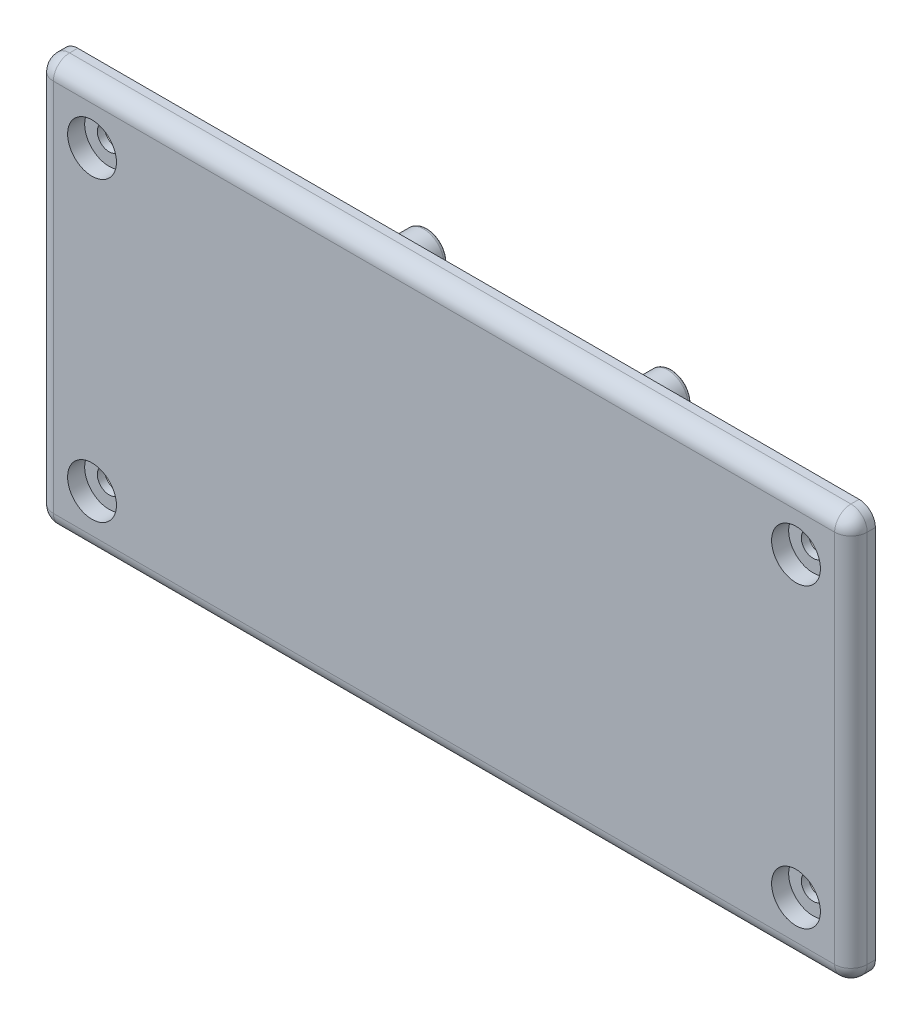
from build123d import *

# Parameters (mm, degrees)
BOSS_EXTRUDE1_DEPTH                                = 3
FILLET1_R                                          = 2
SKETCH2_W                                          = 10
SKETCH2_H                                          = 3
SKETCH2_W_2                                        = 3
SKETCH2_H_2                                        = 20
BOSS_EXTRUDE2_DEPTH                                = 1.5
FILLET2_R                                          = 1
SKETCH3_R                                          = 2.5099
BOSS_EXTRUDE3_DEPTH                                = 10
FILLET3_R                                          = 0.5
CBORE_FOR_M2_5_PAN_HEAD_MACHINE_SCREW1_D           = 2.9
CBORE_FOR_M2_5_PAN_HEAD_MACHINE_SCREW1_DEPTH       = 6.35
CBORE_FOR_M2_5_PAN_HEAD_MACHINE_SCREW1_CBORE_D     = 6
CBORE_FOR_M2_5_PAN_HEAD_MACHINE_SCREW1_CBORE_DEPTH = 2.1
CBORE_FOR_M2_5_PAN_HEAD_MACHINE_SCREW1_TIP         = 0.871247898


with BuildPart() as part:
    # Sketch1 → Boss-Extrude1 (new body)
    with BuildSketch(Plane.XY):
        with BuildLine():
            Line((-48, -25), (48, -25))
            ThreePointArc((48, -25), (49.414213562, -24.414213562), (50, -23))
            Line((50, -23), (50, 23))
            ThreePointArc((50, 23), (49.414213562, 24.414213562), (48, 25))
            Line((48, 25), (-48, 25))
            ThreePointArc((-48, 25), (-49.414213562, 24.414213562), (-50, 23))
            Line((-50, 23), (-50, -23))
            ThreePointArc((-50, -23), (-49.414213562, -24.414213562), (-48, -25))
        make_face()
    extrude(amount=BOSS_EXTRUDE1_DEPTH)

    # Fillet1
    fillet1_edges = [part.edges().sort_by_distance(p)[0] for p in [
        (-50, 0, 3),
        (-49.414213562, 24.414213562, 3),
        (0, 25, 3),
        (49.414213562, 24.414213562, 3),
        (50, 0, 3),
        (49.414213562, -24.414213562, 3),
        (0, -25, 3),
        (-49.414213562, -24.414213562, 3),
    ]]
    fillet(fillet1_edges, radius=FILLET1_R)

    # Sketch2 → Boss-Extrude2 (add)
    with BuildSketch(Plane(origin=(0, 0, 0), x_dir=(-1, 0, 0), z_dir=(0, 0, -1))):
        with Locations((-30, -20)):
            Rectangle(SKETCH2_W, SKETCH2_H)
        with Locations((30, -20)):
            Rectangle(SKETCH2_W, SKETCH2_H)
        with Locations((-45, 0)):
            Rectangle(SKETCH2_W_2, SKETCH2_H_2)
        with Locations((45, 0)):
            Rectangle(SKETCH2_W_2, SKETCH2_H_2)
        with Locations((-30, 20)):
            Rectangle(SKETCH2_W, SKETCH2_H)
        with Locations((30, 20)):
            Rectangle(SKETCH2_W, SKETCH2_H)
    extrude(amount=BOSS_EXTRUDE2_DEPTH)

    # Fillet2
    fillet2_edges = [part.edges().sort_by_distance(p)[0] for p in [
        (-25, 20, -1.5),
        (-30, 21.5, -1.5),
        (-35, 20, -1.5),
        (-30, 18.5, -1.5),
        (-35, -20, -1.5),
        (-30, -21.5, -1.5),
        (-25, -20, -1.5),
        (-30, -18.5, -1.5),
        (-45, 10, -1.5),
        (-46.5, 0, -1.5),
        (-45, -10, -1.5),
        (-43.5, 0, -1.5),
        (25, -20, -1.5),
        (30, -21.5, -1.5),
        (35, -20, -1.5),
        (30, -18.5, -1.5),
        (46.5, 0, -1.5),
        (45, 10, -1.5),
        (43.5, 0, -1.5),
        (45, -10, -1.5),
        (30, 21.5, -1.5),
        (25, 20, -1.5),
        (30, 18.5, -1.5),
        (35, 20, -1.5),
        (-25, 21.5, -0.75),
        (-35, 21.5, -0.75),
        (-35, 18.5, -0.75),
        (-25, 18.5, -0.75),
        (-25, -18.5, -0.75),
        (-25, -21.5, -0.75),
        (-35, -21.5, -0.75),
        (-35, -18.5, -0.75),
        (-46.5, -10, -0.75),
        (-43.5, -10, -0.75),
        (-46.5, 10, -0.75),
        (-43.5, 10, -0.75),
        (25, -18.5, -0.75),
        (25, -21.5, -0.75),
        (35, -18.5, -0.75),
        (35, -21.5, -0.75),
        (25, 21.5, -0.75),
        (25, 18.5, -0.75),
        (35, 21.5, -0.75),
        (35, 18.5, -0.75),
        (43.5, 10, -0.75),
        (46.5, 10, -0.75),
        (46.5, -10, -0.75),
        (43.5, -10, -0.75),
    ]]
    fillet(fillet2_edges, radius=FILLET2_R)

    # Sketch3 → Boss-Extrude3 (add)
    with BuildSketch(Plane(origin=(0, 0, 0), x_dir=(-1, 0, 0), z_dir=(0, 0, -1))):
        with Locations((-14.99997, 14.99997)):
            Circle(SKETCH3_R)
        with Locations((-14.99997, -14.99997)):
            Circle(SKETCH3_R)
        with Locations((14.99997, -14.99997)):
            Circle(SKETCH3_R)
        with Locations((14.99997, 14.99997)):
            Circle(SKETCH3_R)
    extrude(amount=BOSS_EXTRUDE3_DEPTH)

    # Fillet3
    fillet3_edges = [part.edges().sort_by_distance(p)[0] for p in [
        (17.50987, 14.99997, -10),
        (-12.49007, -14.99997, -10),
        (-12.49007, 14.99997, -10),
        (17.50987, -14.99997, -10),
    ]]
    fillet(fillet3_edges, radius=FILLET3_R)

    # CBORE for M2.5 Pan Head Machine Screw1
    with Locations(Plane(origin=(43.250058959, -18.25, 3), x_dir=(1, 0, 0), z_dir=(0, 0, 1))):
        with Locations((0, 0), (0, 36.5), (-86.500117918, 0), (-86.500117918, 36.5)):
            CounterBoreHole(CBORE_FOR_M2_5_PAN_HEAD_MACHINE_SCREW1_D / 2, CBORE_FOR_M2_5_PAN_HEAD_MACHINE_SCREW1_CBORE_D / 2, CBORE_FOR_M2_5_PAN_HEAD_MACHINE_SCREW1_CBORE_DEPTH, depth=CBORE_FOR_M2_5_PAN_HEAD_MACHINE_SCREW1_DEPTH)
            with Locations((0, 0, -(CBORE_FOR_M2_5_PAN_HEAD_MACHINE_SCREW1_DEPTH + CBORE_FOR_M2_5_PAN_HEAD_MACHINE_SCREW1_TIP / 2))):  # 118° drill point
                Cone(0, CBORE_FOR_M2_5_PAN_HEAD_MACHINE_SCREW1_D / 2, CBORE_FOR_M2_5_PAN_HEAD_MACHINE_SCREW1_TIP, mode=Mode.SUBTRACT)


solid = part.part
